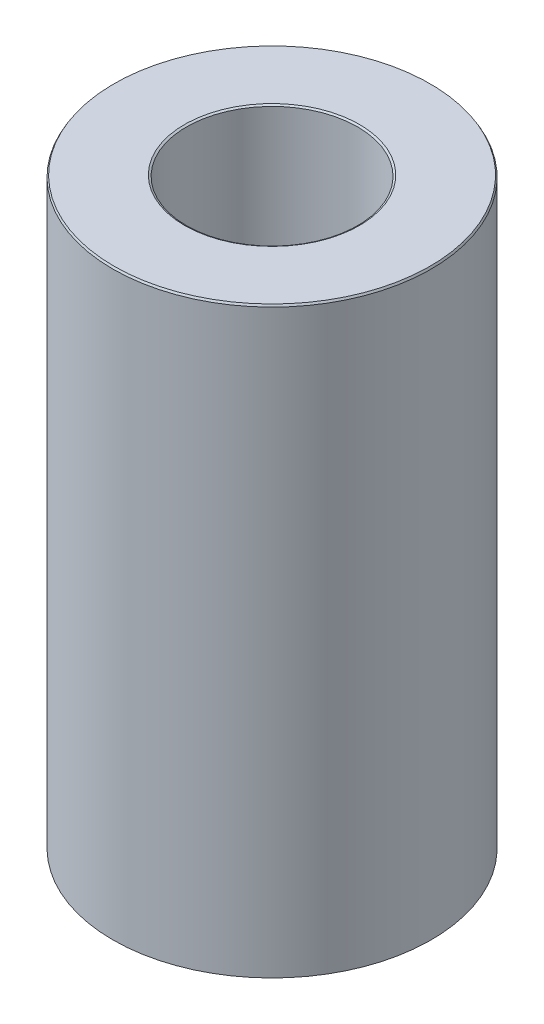
from build123d import *
from OCP.BRepFilletAPI import BRepFilletAPI_MakeChamfer

# Parameters (mm, degrees)
SKETCH1_R           = 52.5
BOSS_EXTRUDE1_DEPTH = 192.659128696
SKETCH2_R           = 28.229915862
CUT_EXTRUDE1_DEPTH  = 207.470433404
CHAMFER1_SIZE       = 0.632966085
CHAMFER1_SIZE2      = 0.365443139


with BuildPart() as part:
    # Sketch1 → Boss-Extrude1 (new body)
    with BuildSketch(Plane(origin=(0, 0, 0), x_dir=(1, 0, 0), z_dir=(0, 1, 0))):
        Circle(SKETCH1_R)
    extrude(amount=BOSS_EXTRUDE1_DEPTH)

    # Sketch2 → Cut-Extrude1 (cut, through all)
    with BuildSketch(Plane(origin=(0, 0, 0), x_dir=(1, 0, 0), z_dir=(0, 1, 0))):
        Circle(SKETCH2_R)
    extrude(amount=CUT_EXTRUDE1_DEPTH, mode=Mode.SUBTRACT)

    # Chamfer1: one chamfer whose edges measure the first distance from different faces: ONE call of the kernel's chamfer builder (chamfer() names one face for all edges)
    chamfer1_edges_1 = [part.edges().sort_by_distance(p)[0] for p in [
        (-28.229915862, 192.659128696, 0),
    ]]
    chamfer1_side_1 = [part.faces().sort_by_distance(p)[0] for p in [
        (-51.01507576, 192.659128696, 0),
    ]]
    chamfer1_edges_2 = [part.edges().sort_by_distance(p)[0] for p in [
        (-28.229915862, 0, 0),
    ]]
    chamfer1_side_2 = [part.faces().sort_by_distance(p)[0] for p in [
        (-28.229915862, 96.329564348, 0),
    ]]
    chamfer1_edges_3 = [part.edges().sort_by_distance(p)[0] for p in [
        (-52.5, 0, 0),
    ]]
    chamfer1_side_3 = [part.faces().sort_by_distance(p)[0] for p in [
        (-51.01507576, 0, 0),
    ]]
    chamfer1_edges_4 = [part.edges().sort_by_distance(p)[0] for p in [
        (-52.5, 192.659128696, 0),
    ]]
    chamfer1_side_4 = [part.faces().sort_by_distance(p)[0] for p in [
        (-52.5, 96.329564348, 0),
    ]]
    chamfer1 = BRepFilletAPI_MakeChamfer(part.part.solid().wrapped)
    for e in chamfer1_edges_1:
        chamfer1.Add(CHAMFER1_SIZE, CHAMFER1_SIZE2, e.wrapped, chamfer1_side_1[0].wrapped)  # the first distance lies on this face
    for e in chamfer1_edges_2:
        chamfer1.Add(CHAMFER1_SIZE, CHAMFER1_SIZE2, e.wrapped, chamfer1_side_2[0].wrapped)  # the first distance lies on this face
    for e in chamfer1_edges_3:
        chamfer1.Add(CHAMFER1_SIZE, CHAMFER1_SIZE2, e.wrapped, chamfer1_side_3[0].wrapped)  # the first distance lies on this face
    for e in chamfer1_edges_4:
        chamfer1.Add(CHAMFER1_SIZE, CHAMFER1_SIZE2, e.wrapped, chamfer1_side_4[0].wrapped)  # the first distance lies on this face
    add(Compound.cast(chamfer1.Shape()), mode=Mode.REPLACE)


solid = part.part
